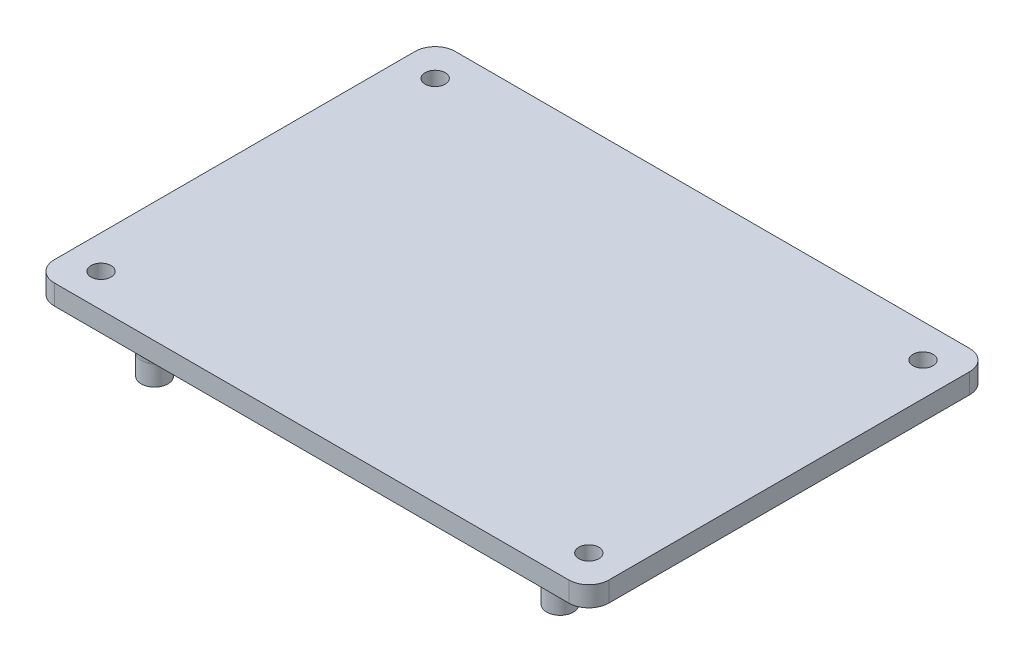
from build123d import *

# Parameters (mm, degrees)
SKETCH3_W           = 83
SKETCH3_H           = 60
BOSS_EXTRUDE1_DEPTH = 3
SKETCH4_R           = 1.5
CUT_EXTRUDE1_DEPTH  = 3
FILLET2_R           = 3
FILLET3_R           = 3
SKETCH8_R           = 2
BOSS_EXTRUDE2_DEPTH = 6
FILLET4_R           = 3
SKETCH9_R           = 0.3
CUT_EXTRUDE2_DEPTH  = 3


with BuildPart() as part:
    # Sketch3 → Boss-Extrude1 (new body)
    with BuildSketch(Plane(origin=(0, 0, 0), x_dir=(1, 0, 0), z_dir=(0, 1, 0))):
        Rectangle(SKETCH3_W, SKETCH3_H)
    extrude(amount=BOSS_EXTRUDE1_DEPTH)

    # Sketch4 → Cut-Extrude1 (cut)
    with BuildSketch(Plane(origin=(0, 3, 0), x_dir=(1, 0, 0), z_dir=(0, 1, 0))):
        with Locations(Location((-36.5, 25, 0), (0, 0, 270))):
            Circle(SKETCH4_R)
        with Locations(Location((36.5, 25, 0), (0, 0, 270))):
            Circle(SKETCH4_R)
        with Locations(Location((36.5, -25, 0), (0, 0, 270))):
            Circle(SKETCH4_R)
        with Locations(Location((-36.5, -25, 0), (0, 0, 270))):
            Circle(SKETCH4_R)
    extrude(amount=-CUT_EXTRUDE1_DEPTH, mode=Mode.SUBTRACT)

    # Fillet2
    fillet2_edges = [part.edges().sort_by_distance(p)[0] for p in [
        (-41.5, 1.5, 30),
    ]]
    fillet(fillet2_edges, radius=FILLET2_R)

    # Fillet3
    fillet3_edges = [part.edges().sort_by_distance(p)[0] for p in [
        (-41.5, 1.5, -30),
        (41.5, 1.5, -30),
        (41.5, 1.5, 30),
    ]]
    fillet(fillet3_edges, radius=FILLET3_R)

    # Sketch8 → Boss-Extrude2 (add)
    with BuildSketch(Plane(origin=(0, 0, 0), x_dir=(-1, 0, 0), z_dir=(0, -1, 0))):
        with Locations(Location((27.892503865, -25.595481363, 0), (0, 0, 90))):
            Circle(SKETCH8_R)
        with Locations(Location((-32.019288728, -24.830385061, 0), (0, 0, 90))):
            Circle(SKETCH8_R)
        with Locations(Location((-32.019288728, 24.653970247, 0), (0, 0, 90))):
            Circle(SKETCH8_R)
        with Locations(Location((27.892503865, 24.404518637, 0), (0, 0, 90))):
            Circle(SKETCH8_R)
    extrude(amount=BOSS_EXTRUDE2_DEPTH)

    # Fillet4
    fillet4_edges = [part.edges().sort_by_distance(p)[0] for p in [
        (-27.892503865, 0, -22.404518637),
    ]]
    fillet(fillet4_edges, radius=FILLET4_R)
    fillet4_2_edges = [part.edges().sort_by_distance(p)[0] for p in [
        (-27.892503865, 0, 27.595481363),
    ]]
    fillet(fillet4_2_edges, radius=FILLET4_R)
    # the kernel refuses this fillet: 3 mm, written as the material it adds along each edge
    with BuildSketch(Plane(origin=(32.019288728, 0, 24.830385061), x_dir=(0, 0, -1), z_dir=(-1, 0, 0))) as fillet4_3_piece_1_section:
        with BuildLine():
            CenterArc((2 + FILLET4_R, FILLET4_R), FILLET4_R, 180, 90)
            Line((2, FILLET4_R), (2 - FILLET4_R * 0.02, FILLET4_R))
            Line((2 - FILLET4_R * 0.02, FILLET4_R), (2 - FILLET4_R * 0.02, -FILLET4_R * 0.02))
            Line((2 - FILLET4_R * 0.02, -FILLET4_R * 0.02), (2 + FILLET4_R, -FILLET4_R * 0.02))
            Line((2 + FILLET4_R, -FILLET4_R * 0.02), (2 + FILLET4_R, 0))
        make_face()
    fillet4_3_piece_1 = revolve(axis=Axis((32.019288728, 0, 24.830385061), (0, -1, 0)), mode=Mode.PRIVATE)
    fillet4_3_piece_1 = fillet4_3_piece_1 - Plane(origin=(36.5, -0.855015512, 25), x_dir=(0, 0, 1), z_dir=(0, 1, 0)) * Cylinder(1.5, 21, mode=Mode.PRIVATE)
    add(fillet4_3_piece_1)
    # the kernel refuses this fillet: 3 mm, written as the material it adds along each edge
    with BuildSketch(Plane(origin=(32.019288728, 0, -24.653970247), x_dir=(0, 0, -1), z_dir=(-1, 0, 0))) as fillet4_4_piece_1_section:
        with BuildLine():
            CenterArc((2 + FILLET4_R, FILLET4_R), FILLET4_R, 180, 90)
            Line((2, FILLET4_R), (2 - FILLET4_R * 0.02, FILLET4_R))
            Line((2 - FILLET4_R * 0.02, FILLET4_R), (2 - FILLET4_R * 0.02, -FILLET4_R * 0.02))
            Line((2 - FILLET4_R * 0.02, -FILLET4_R * 0.02), (2 + FILLET4_R, -FILLET4_R * 0.02))
            Line((2 + FILLET4_R, -FILLET4_R * 0.02), (2 + FILLET4_R, 0))
        make_face()
    fillet4_4_piece_1 = revolve(axis=Axis((32.019288728, 0, -24.653970247), (0, -1, 0)), mode=Mode.PRIVATE)
    fillet4_4_piece_1 = fillet4_4_piece_1 - Plane(origin=(36.5, -0.855011953, -25), x_dir=(0, 0, 1), z_dir=(0, 1, 0)) * Cylinder(1.5, 21, mode=Mode.PRIVATE)
    add(fillet4_4_piece_1)

    # Sketch9 → Cut-Extrude2 (cut)
    with BuildSketch(Plane(origin=(0, -6, 0), x_dir=(-1, 0, 0), z_dir=(0, -1, 0))):
        with Locations(Location((27.961748008, -25.447836909, 0), (0, 0, 90))):
            Circle(SKETCH9_R)
        with Locations(Location((-32.019288728, 24.653970247, 0), (0, 0, 90))):
            Circle(SKETCH9_R)
        with Locations(Location((27.892503865, 24.404518637, 0), (0, 0, 90))):
            Circle(SKETCH9_R)
        with Locations(Location((-32.019288728, -24.830385061, 0), (0, 0, 90))):
            Circle(SKETCH9_R)
    extrude(amount=-CUT_EXTRUDE2_DEPTH, mode=Mode.SUBTRACT)


solid = part.part
